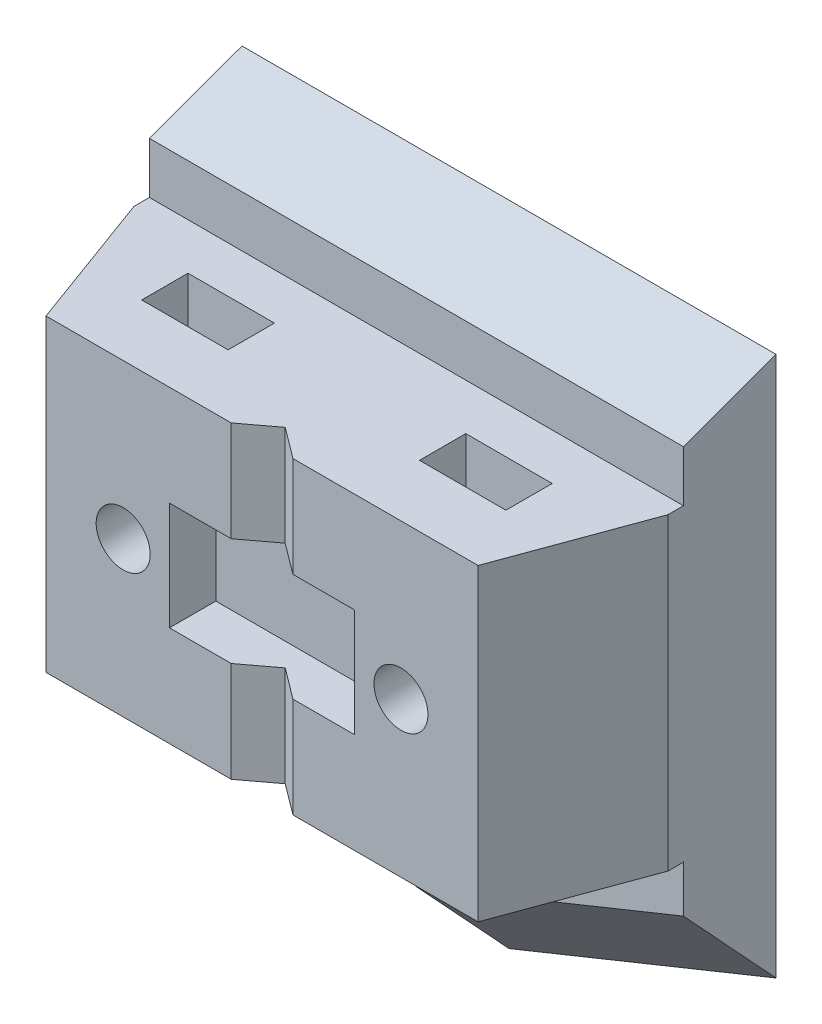
from build123d import *

# Parameters (mm, degrees)
ESBO_O1_W                = 34.6
ESBO_O1_H                = 26
RESSALTO_EXTRUS_O1_DEPTH = 7
ESBO_O10_W               = 34.6
ESBO_O10_H               = 2.5
RESSALTO_EXTRUS_O4_DEPTH = 7
CHANFRO1_SIZE            = 7
CHANFRO2_SIZE2           = 7
CHANFRO2_SIZE            = 2.54779164
ESBO_O11_W               = 5.6
ESBO_O11_H               = 3
RESSALTO_EXTRUS_O5_DEPTH = 10
ESBO_O12_R               = 1.75
CORTE_EXTRUS_O1_DEPTH    = 20
ESBO_O13_W               = 34.6
ESBO_O13_H               = 5.5
ESBO_O13_H_2             = 18.393079324
CORTE_EXTRUS_O2_DEPTH    = 1
ESBO_O14_W               = 12
ESBO_O14_H               = 7
CORTE_EXTRUS_O3_DEPTH    = 3


with BuildPart() as part:
    # Esboço1 → Ressalto-extrusão1 (new body)
    with BuildSketch(Plane.XY):
        Rectangle(ESBO_O1_W, ESBO_O1_H)
    extrude(amount=RESSALTO_EXTRUS_O1_DEPTH)

    # Esboço10 → Ressalto-extrusão4 (add)
    with BuildSketch(Plane(origin=(0, 0, 0), x_dir=(-1, 0, 0), z_dir=(0, 0, -1))):
        Polygon((-17.3, -19.5), (0, -26.5), (17.3, -19.5), (17.3, -13), (-17.3, -13), align=None)
        with Locations((0, 14.25)):
            Rectangle(ESBO_O10_W, ESBO_O10_H)
    extrude(amount=-RESSALTO_EXTRUS_O4_DEPTH)

    # Chanfro1
    chanfro1_edges = [part.edges().sort_by_distance(p)[0] for p in [
        (8.65, -23, 7),
        (-8.65, -23, 7),
    ]]
    chamfer(chanfro1_edges, length=CHANFRO1_SIZE - 0.0001)  # a hair under: the kernel refuses the full size

    # Chanfro2
    chanfro2_edges = [part.edges().sort_by_distance(p)[0] for p in [
        (0, 15.5, 7),
    ]]
    chanfro2_side = [part.faces().sort_by_distance(p)[0] for p in [
        (0, 15.449044167, 7),
    ]]
    chamfer(chanfro2_edges, length=CHANFRO2_SIZE - 0.0001, length2=CHANFRO2_SIZE2 - 0.0001, reference=chanfro2_side[0])  # a hair under: the kernel refuses the full size

    # Esboço11 → Ressalto-extrusão5 (add, symmetric)
    with BuildSketch(Plane(origin=(0, 0, 0), x_dir=(1, 0, 0), z_dir=(0, 1, 0))):
        Polygon((-17.3, -7), (-14, -16), (-2, -16), (0, -14.5), (2, -16), (14, -16), (17.3, -7), align=None)
        with Locations((-9, -10.5)):
            Rectangle(ESBO_O11_W, ESBO_O11_H, mode=Mode.SUBTRACT)
        with Locations((9, -10.5)):
            Rectangle(ESBO_O11_W, ESBO_O11_H, mode=Mode.SUBTRACT)
    extrude(amount=RESSALTO_EXTRUS_O5_DEPTH, both=True)

    # Esboço12 → Corte-extrusão1 (cut)
    with BuildSketch(Plane.XY.offset(16)):
        with Locations((-9, 0)):
            Circle(ESBO_O12_R)
        with Locations(Location((9, 0, 0), (0, 0, 180))):
            Circle(ESBO_O12_R)
    extrude(amount=-CORTE_EXTRUS_O1_DEPTH, mode=Mode.SUBTRACT)

    # Esboço13 → Corte-extrusão2 (cut)
    with BuildSketch(Plane.XY.offset(7)):
        with Locations((0, 12.75)):
            Rectangle(ESBO_O13_W, ESBO_O13_H)
        with Locations((0, -19.196539662)):
            Rectangle(ESBO_O13_W, ESBO_O13_H_2)
    extrude(amount=-CORTE_EXTRUS_O2_DEPTH, mode=Mode.SUBTRACT)

    # Esboço14 → Corte-extrusão3 (cut)
    with BuildSketch(Plane.XY.offset(16)):
        Rectangle(ESBO_O14_W, ESBO_O14_H)
    extrude(amount=-CORTE_EXTRUS_O3_DEPTH, mode=Mode.SUBTRACT)


solid = part.part
